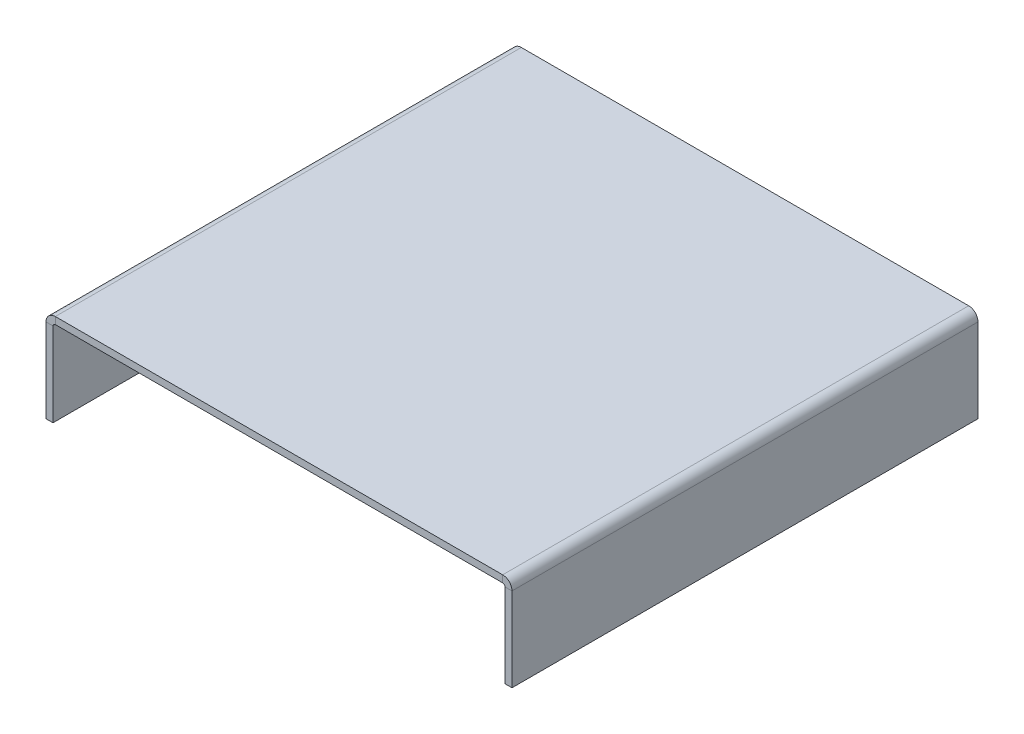
from build123d import *

# Parameters (mm, degrees)
SKETCH1_W                      = 100
SKETCH1_H                      = 100
BASE_FLANGE1_DEPTH             = 1.5
EDGE_FLANGE1_STRIP_W           = 7
EDGE_FLANGE1_STRIP_H           = 1.5
EDGE_FLANGE1_STRIP_CUT_DEPTH   = 100
EDGE_FLANGE1_STRIP_2_W         = 7
EDGE_FLANGE1_STRIP_2_H         = 1.5
EDGE_FLANGE1_STRIP_CUT_2_DEPTH = 100
EDGE_FLANGE1_DEPTH             = 100
EDGE_FLANGE1_BEND_DEPTH        = 100


# Sheet-metal steps are written as plain solids
with BuildPart() as part:
    # Sketch1 → Base-Flange1 (new body)
    with BuildSketch(Plane(origin=(0, 0, 0), x_dir=(1, 0, 0), z_dir=(0, 1, 0))):
        Rectangle(SKETCH1_W, SKETCH1_H)
    extrude(amount=-BASE_FLANGE1_DEPTH)

    # Edge-Flange1 strip (across the edge) → Edge-Flange1 strip cut (cut)
    with BuildSketch(Plane(origin=(50, -1.5, -50), x_dir=(-1, 0, 0), z_dir=(0, 0, 1))):
        with Locations((-1.5, -0.75)):
            Rectangle(EDGE_FLANGE1_STRIP_W, EDGE_FLANGE1_STRIP_H)
    extrude(amount=EDGE_FLANGE1_STRIP_CUT_DEPTH, mode=Mode.SUBTRACT)

    # Edge-Flange1 strip 2 (across the edge) → Edge-Flange1 strip cut 2 (cut)
    with BuildSketch(Plane(origin=(-50, -1.5, 50), x_dir=(1, 0, 0), z_dir=(0, 0, -1))):
        with Locations((-1.5, -0.75)):
            Rectangle(EDGE_FLANGE1_STRIP_2_W, EDGE_FLANGE1_STRIP_2_H)
    extrude(amount=EDGE_FLANGE1_STRIP_CUT_2_DEPTH, mode=Mode.SUBTRACT)

    # Edge-Flange1 section (across the edge) → Edge-Flange1 (add)
    with BuildSketch(Plane(origin=(50, -1.5, -50), x_dir=(-1, 0, 0), z_dir=(0, 0, 1))):
        with BuildLine():
            Line((0, 0.5), (0, 18.5))
            Line((0, 18.5), (1.5, 18.5))
            Line((1.5, 18.5), (1.5, 0.5))
            ThreePointArc((1.5, 0.5), (1.646446609, 0.146446609), (2, 0))
            Line((2, 0), (2, -1.5))
            ThreePointArc((2, -1.5), (0.585786438, -0.914213562), (0, 0.5))
        make_face()
    extrude(amount=EDGE_FLANGE1_DEPTH)

    # Edge-Flange1 section 2 (across the edge) → Edge-Flange1 bend (add)
    with BuildSketch(Plane(origin=(-50, -1.5, 50), x_dir=(1, 0, 0), z_dir=(0, 0, -1))):
        with BuildLine():
            Line((0, 0.5), (0, 18.5))
            Line((0, 18.5), (1.5, 18.5))
            Line((1.5, 18.5), (1.5, 0.5))
            ThreePointArc((1.5, 0.5), (1.646446609, 0.146446609), (2, 0))
            Line((2, 0), (2, -1.5))
            ThreePointArc((2, -1.5), (0.585786438, -0.914213562), (0, 0.5))
        make_face()
    extrude(amount=EDGE_FLANGE1_BEND_DEPTH)


solid = part.part
